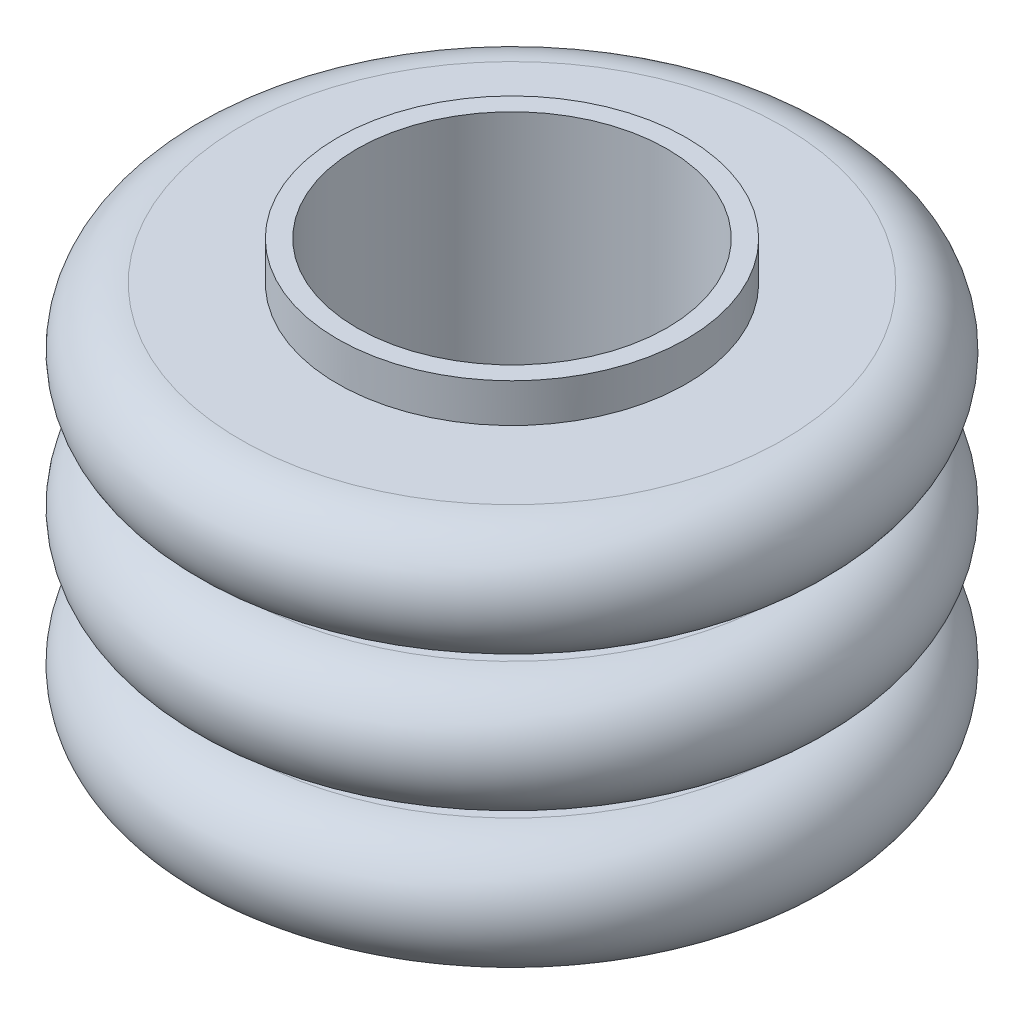
from build123d import *

# Parameters (mm, degrees)
SKETCH1_R           = 5.715
SKETCH1_R_2         = 5.08
BOSS_EXTRUDE1_DEPTH = 13.97
SKETCH2_R           = 10.795
SKETCH2_R_2         = 5.715
BOSS_EXTRUDE2_DEPTH = 3.81
LPATTERN1_COUNT     = 3
LPATTERN1_PITCH     = 4.445
FILLET1_R           = 1.905
FILLET2_R           = 1.905
FILLET3_R           = 1.905


with BuildPart() as part:
    # Sketch1 → Boss-Extrude1 (new body)
    with BuildSketch(Plane(origin=(0, 0, 0), x_dir=(1, 0, 0), z_dir=(0, 1, 0))):
        with Locations(Location((0, 0, 0), (0, 0, 270))):
            Circle(SKETCH1_R)
        with Locations(Location((0, 0, 0), (0, 0, 270))):
            Circle(SKETCH1_R_2, mode=Mode.SUBTRACT)
    extrude(amount=BOSS_EXTRUDE1_DEPTH)

    # Sketch2 → Boss-Extrude2 (add)
    with BuildSketch(Plane.XZ):
        with Locations(Location((0, 0, 0), (0, 0, 270))):
            Circle(SKETCH2_R)
        with Locations(Location((0, 0, 0), (0, 0, 270))):
            Circle(SKETCH2_R_2, mode=Mode.SUBTRACT)
    boss_extrude2 = extrude(amount=-BOSS_EXTRUDE2_DEPTH)

    # LPattern1: Boss-Extrude2 ×3
    with Locations(*[(0, i * LPATTERN1_PITCH, 0) for i in range(1, LPATTERN1_COUNT)]):
        add(boss_extrude2)

    # Fillet1
    fillet1_edges = [part.edges().sort_by_distance(p)[0] for p in [
        (0, 3.81, 10.795),
        (0, 0, 10.795),
    ]]
    fillet(fillet1_edges, radius=FILLET1_R - 0.0001)  # a hair under: the kernel refuses the full size

    # Fillet2
    fillet2_edges = [part.edges().sort_by_distance(p)[0] for p in [
        (0, 8.255, 10.795),
        (0, 4.445, 10.795),
    ]]
    fillet(fillet2_edges, radius=FILLET2_R - 0.0001)  # a hair under: the kernel refuses the full size

    # Fillet3
    fillet3_edges = [part.edges().sort_by_distance(p)[0] for p in [
        (0, 12.7, 10.795),
        (0, 8.89, 10.795),
    ]]
    fillet(fillet3_edges, radius=FILLET3_R - 0.0001)  # a hair under: the kernel refuses the full size


solid = part.part
